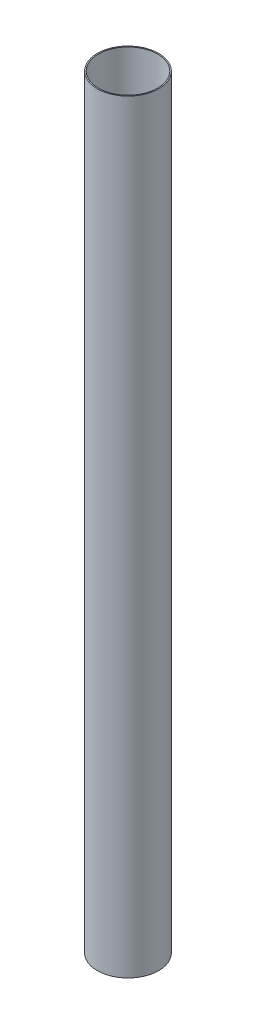
from build123d import *

# Parameters (mm, degrees)
SKETCH1_R           = 41
SKETCH1_R_2         = 39.5
BOSS_EXTRUDE1_DEPTH = 1020


with BuildPart() as part:
    # Sketch1 → Boss-Extrude1 (new body)
    with BuildSketch(Plane(origin=(0, 0, 0), x_dir=(1, 0, 0), z_dir=(0, 1, 0))):
        Circle(SKETCH1_R)
        Circle(SKETCH1_R_2, mode=Mode.SUBTRACT)
    extrude(amount=BOSS_EXTRUDE1_DEPTH)


solid = part.part
